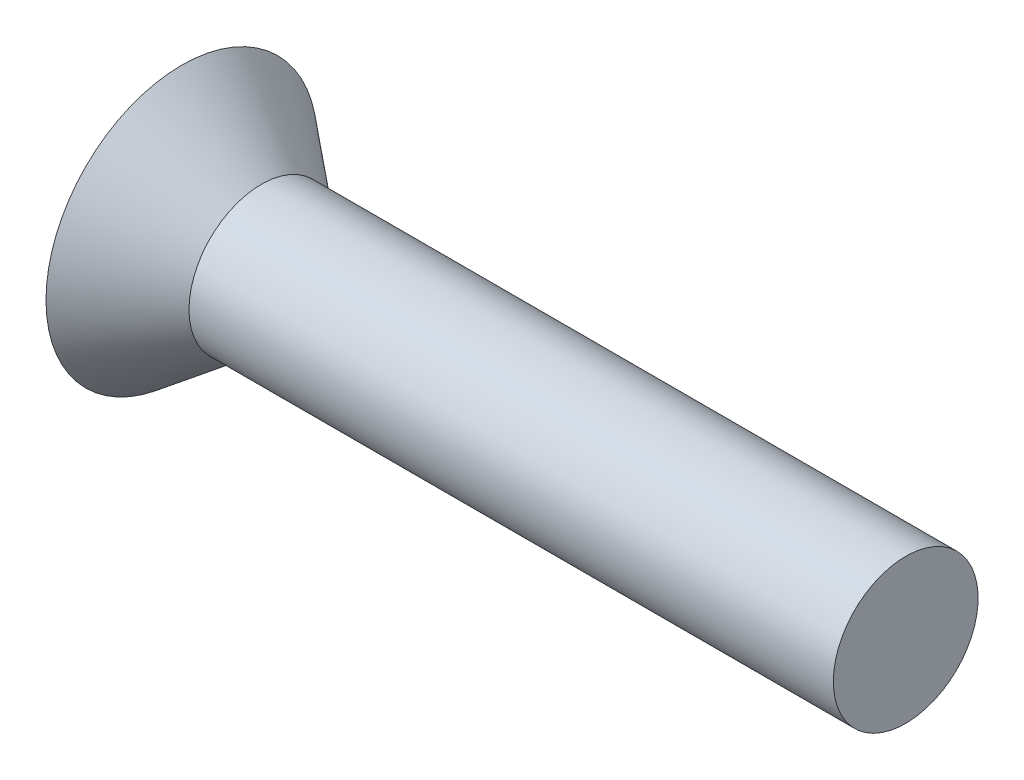
from build123d import *


with BuildPart() as part:
    # Sketch1 → Revolve1 (revolve)
    with BuildSketch(Plane.XY):
        Polygon((0, 0), (0, 3.75), (2.2, 2), (20, 2), (20, 0), align=None)
    revolve(axis=Axis((0, 0, 0), (1, 0, 0)))


solid = part.part
